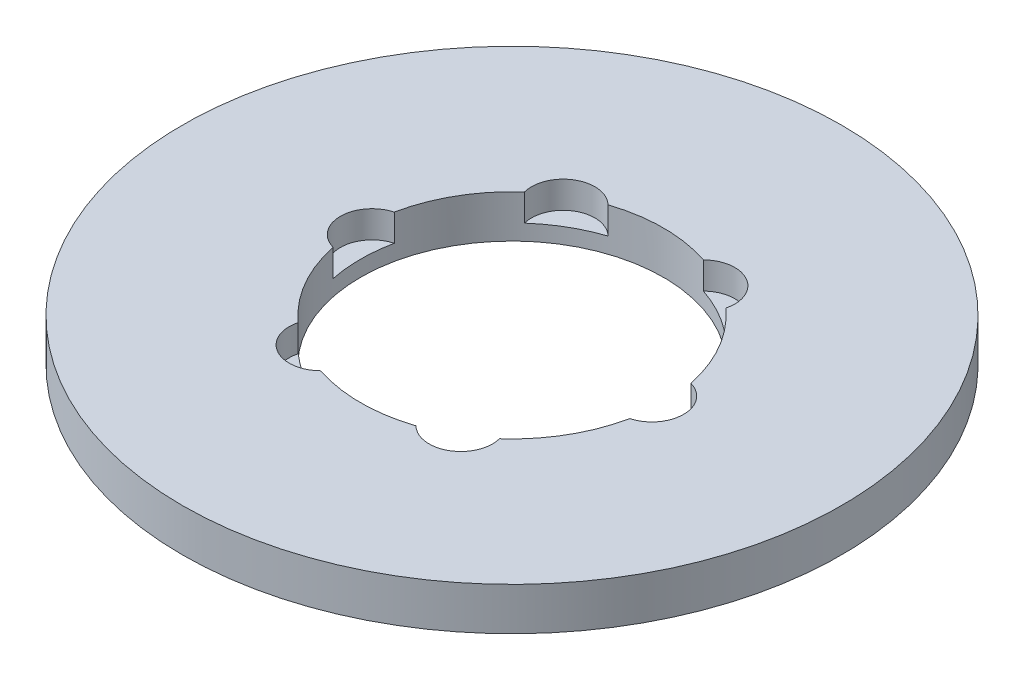
from build123d import *

# Parameters (mm, degrees)
SKETCH1_R           = 92.5
BOSS_EXTRUDE1_DEPTH = 12
SKETCH2_R           = 42.5
CUT_EXTRUDE1_DEPTH  = 132.363998112
SKETCH3_R           = 8.89999986
CUT_EXTRUDE2_DEPTH  = 7.586899505
CIRPATTERN1_COUNT   = 6


with BuildPart() as part:
    # Sketch1 → Boss-Extrude1 (new body)
    with BuildSketch(Plane(origin=(0, 0, 0), x_dir=(1, 0, 0), z_dir=(0, 1, 0))):
        Circle(SKETCH1_R)
    extrude(amount=BOSS_EXTRUDE1_DEPTH)

    # Sketch2 → Cut-Extrude1 (cut, through all)
    with BuildSketch(Plane(origin=(0, 0, 0), x_dir=(1, 0, 0), z_dir=(0, 1, 0))):
        Circle(SKETCH2_R)
    extrude(amount=CUT_EXTRUDE1_DEPTH, mode=Mode.SUBTRACT)

    # Sketch3 → Cut-Extrude2 (cut)
    with BuildSketch(Plane(origin=(0, 12, 0), x_dir=(1, 0, 0), z_dir=(0, 1, 0))):
        with Locations((-39.261748447, 0)):
            Circle(SKETCH3_R)
    cut_extrude2 = extrude(amount=-CUT_EXTRUDE2_DEPTH, mode=Mode.SUBTRACT)

    # CirPattern1: Cut-Extrude2 ×6 about axis
    cirpattern1_axis = Axis((0, 0, 0), (0, 1, 0))
    for i in range(1, CIRPATTERN1_COUNT):
        add(cut_extrude2.rotate(cirpattern1_axis, i * 360 / CIRPATTERN1_COUNT), mode=Mode.SUBTRACT)


solid = part.part
